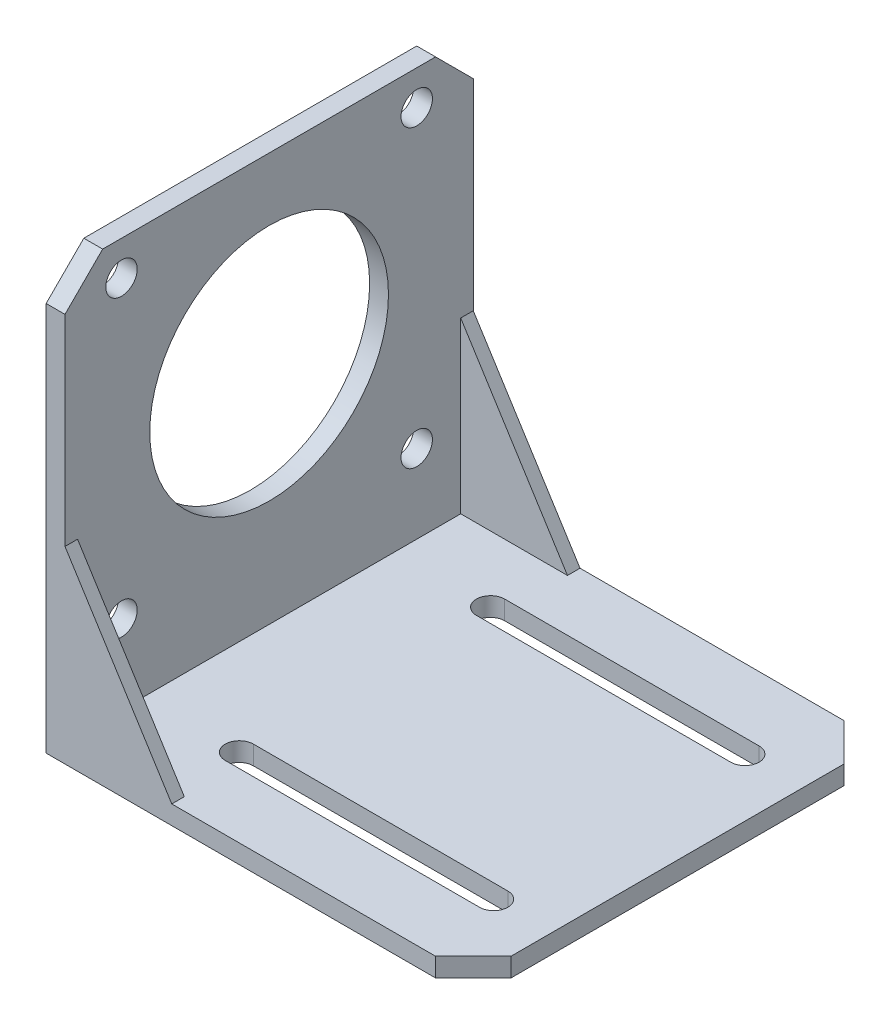
from build123d import *

# Parameters (mm, degrees)
EXTRUDE_1_DEPTH             = 65
HOLE_WIZARD_4_5_4_5_1_DEPTH = 3
SKETCH_4_R                  = 19
CUT_EXTRUDE_1_DEPTH         = 65
HOLE_WIZARD_5_0_5_1_D       = 5
CHAMFER_1_SIZE              = 6
RIB_18_REACH                = 118.073
SKETCH_9_WALL_W             = 266.052617732
SKETCH_9_WALL_H             = 2
RIB_19_REACH                = 118.073
SKETCH_8_WALL_W             = 266.052617732
SKETCH_8_WALL_H             = 2


# Read off the part's stored shape, not the designer's step: Ø4.5 (4.5) 直径槽口1
with BuildPart() as part:
    # 草图1 → 凸台-拉伸1 (new body)
    with BuildSketch(Plane.XY):
        Polygon((0, 0), (0, 68), (3, 68), (3, 3), (68, 3), (68, 0), align=None)
    extrude(amount=EXTRUDE_1_DEPTH)

    # Ø4.5 (4.5) 直径槽口1 outline → Ø4.5 (4.5) 直径槽口1 (cut)
    with BuildSketch(Plane(origin=(0, 0, 0), x_dir=(1, 0, 0), z_dir=(0, 1, 0))):
        with BuildLine():
            Line((18.25, -14.75), (58.75, -14.75))
            ThreePointArc((58.75, -14.75), (61, -12.5), (58.75, -10.25))
            Line((58.75, -10.25), (18.25, -10.25))
            ThreePointArc((18.25, -10.25), (16, -12.5), (18.25, -14.75))
        make_face()
        with BuildLine():
            Line((18.25, -54.75), (58.75, -54.75))
            ThreePointArc((58.75, -54.75), (61, -52.5), (58.75, -50.25))
            Line((58.75, -50.25), (18.25, -50.25))
            ThreePointArc((18.25, -50.25), (16, -52.5), (18.25, -54.75))
        make_face()
    extrude(amount=HOLE_WIZARD_4_5_4_5_1_DEPTH, mode=Mode.SUBTRACT)

    # 草图4 → 切除-拉伸1 (cut)
    with BuildSketch(Plane.ZY):
        with Locations((32.5, 39)):
            Circle(SKETCH_4_R)
    extrude(amount=-CUT_EXTRUDE_1_DEPTH, mode=Mode.SUBTRACT)

    # Ø5.0 (5) 直径孔1 (through all)
    with Locations(Plane.ZY):
        with Locations((9, 62.5), (56, 62.5), (9, 15.5), (56, 15.5)):
            Hole(HOLE_WIZARD_5_0_5_1_D / 2)

    # 倒角1
    chamfer_1_edges = [part.edges().sort_by_distance(p)[0] for p in [
        (1.5, 68, 65),
        (1.5, 68, 0),
        (68, 1.5, 65),
        (68, 1.5, 0),
    ]]
    chamfer(chamfer_1_edges, length=CHAMFER_1_SIZE)

    # 草图9 wall → 筋18 (add, up to next)
    with BuildSketch(Plane(origin=(11.5, 16.5, 0), x_dir=(0.532813269686, -0.84623284009, 0), z_dir=(0.84623284009, 0.532813269686, 0)), mode=Mode.PRIVATE) as rib_18_sk1:
        with Locations((0, -1)):
            Rectangle(SKETCH_9_WALL_W, SKETCH_9_WALL_H)
    rib_18_tool1 = extrude(rib_18_sk1.sketch, amount=-RIB_18_REACH, mode=Mode.PRIVATE) - part.part
    add(rib_18_tool1.solids().sort_by_distance((11.5, 16.5, 0))[0])

    # 草图8 wall → 筋19 (add, up to next)
    with BuildSketch(Plane(origin=(11.5, 16.5, 65), x_dir=(0.532813269686, -0.84623284009, 0), z_dir=(0.84623284009, 0.532813269686, 0)), mode=Mode.PRIVATE) as rib_19_sk1:
        with Locations((0, 1)):
            Rectangle(SKETCH_8_WALL_W, SKETCH_8_WALL_H)
    rib_19_tool1 = extrude(rib_19_sk1.sketch, amount=-RIB_19_REACH, mode=Mode.PRIVATE) - part.part
    add(rib_19_tool1.solids().sort_by_distance((11.5, 16.5, 65))[0])


solid = part.part
